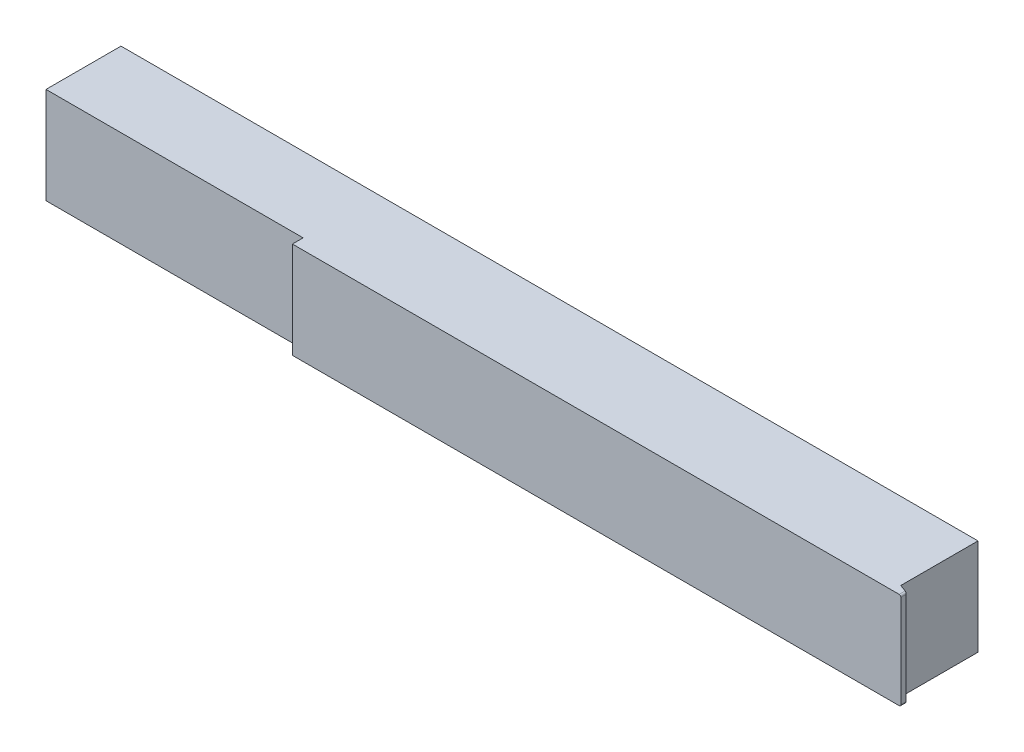
from build123d import *

# Parameters (mm, degrees)
SKETCH1_W           = 22.5
SKETCH1_H           = 202
BOSS_EXTRUDE1_DEPTH = 20
SKETCH2_W           = 22.5
SKETCH2_H           = 18
CUT_EXTRUDE1_DEPTH  = 2
CHAMFER5_SIZE       = 2.060608065
CHAMFER5_SIZE_2     = 0.75
FILLET5_R           = 0.4
SKETCH3_W           = 60
SKETCH3_H           = 2.5
CUT_EXTRUDE2_DEPTH  = 22.5


with BuildPart() as part:
    # Sketch1 → Boss-Extrude1 (new body)
    with BuildSketch(Plane(origin=(0, 0, 0), x_dir=(0, 1, 0), z_dir=(0, 0, 1))):
        with Locations((11.25, -101)):
            Rectangle(SKETCH1_W, SKETCH1_H)
    extrude(amount=-BOSS_EXTRUDE1_DEPTH)

    # Sketch2 → Cut-Extrude1 (cut)
    with BuildSketch(Plane.YZ.offset(202)):
        with Locations((11.25, -11)):
            Rectangle(SKETCH2_W, SKETCH2_H)
    extrude(amount=-CUT_EXTRUDE1_DEPTH, mode=Mode.SUBTRACT)

    # Chamfer5
    # the kernel refuses this chamfer: 2.060608065, 0.75 mm, written as the material it takes off along each edge
    with BuildSketch(Plane(origin=(202, 27.845618587, -2), x_dir=(-0.9999130865277316, 0, -0.013184058198645886), z_dir=(0, -1, 0))) as chamfer5_piece_1_section:
        Polygon((CHAMFER5_SIZE * 0.999913086329, -CHAMFER5_SIZE * 0.013184058196), (-CHAMFER5_SIZE_2 * 0.0131840581986, -CHAMFER5_SIZE_2 * 0.999913086528), (0, 0), align=None)
    chamfer5_piece_1 = extrude(amount=33.191237174, mode=Mode.PRIVATE)
    chamfer5_piece_1 = split(chamfer5_piece_1, bisect_by=Plane(origin=(200, 11.25, -1.766801206), z_dir=(1, 0, 0)), keep=Keep.TOP, mode=Mode.PRIVATE)
    add(chamfer5_piece_1, mode=Mode.SUBTRACT)

    # Fillet5
    fillet5_edges = [part.edges().sort_by_distance(p)[0] for p in [
        (202, 0, -0.625),
        (202, 22.5, -0.625),
    ]]
    fillet(fillet5_edges, radius=FILLET5_R)

    # Sketch3 → Cut-Extrude2 (cut)
    with BuildSketch(Plane(origin=(0, 22.5, 0), x_dir=(-1, 0, 0), z_dir=(0, 1, 0))):
        with Locations((-30, -1.25)):
            Rectangle(SKETCH3_W, SKETCH3_H)
    extrude(amount=-CUT_EXTRUDE2_DEPTH, mode=Mode.SUBTRACT)


solid = part.part
